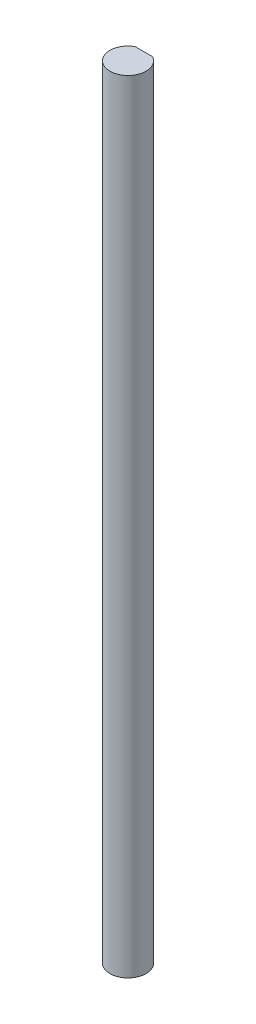
from build123d import *

# Parameters (mm, degrees)
BOSS_EXTRUDE1_DEPTH = 173


with BuildPart() as part:
    # Sketch1 → Boss-Extrude1 (new body)
    with BuildSketch(Plane(origin=(0, 0, 0), x_dir=(1, 0, 0), z_dir=(0, 1, 0))):
        with BuildLine():
            Line((-1.936491673, 3.5), (1.936491673, 3.5))
            ThreePointArc((1.936491673, 3.5), (0, -4), (-1.936491673, 3.5))
        make_face()
    extrude(amount=BOSS_EXTRUDE1_DEPTH)


solid = part.part
